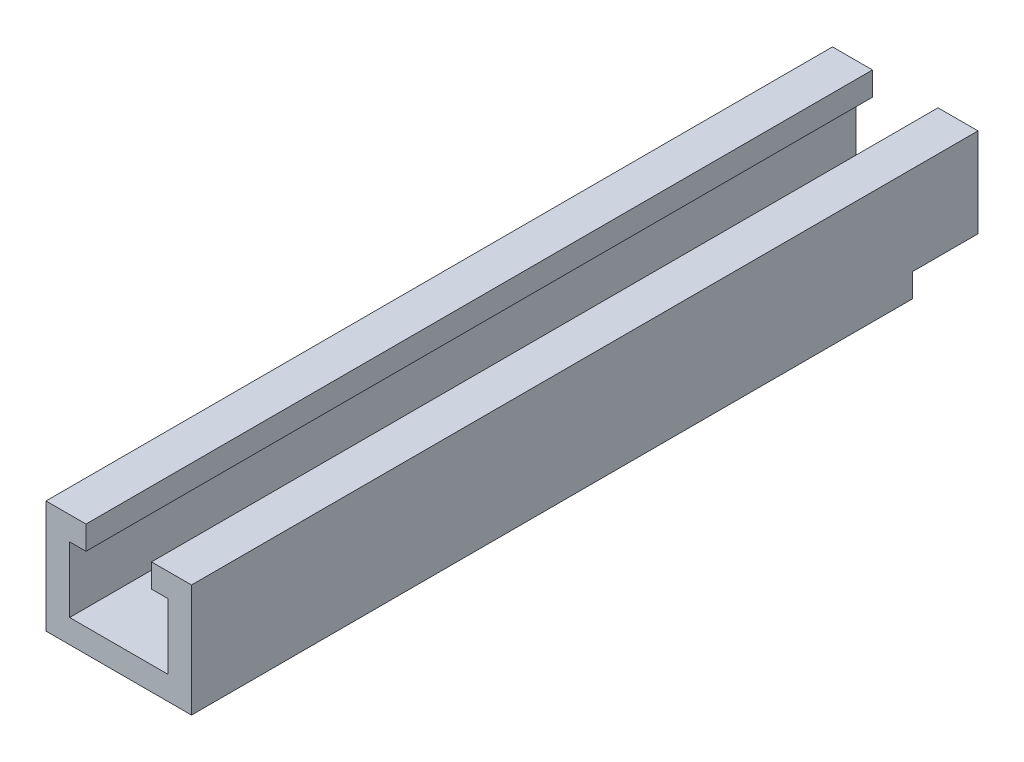
from build123d import *

# Parameters (mm, degrees)
SKETCH1_W                         = 111
SKETCH1_H                         = 18
BASEPLATE_DEPTH                   = 600
SKETCH2_W                         = 18
SKETCH2_H                         = 600
SIDE_RAIL_DEPTH                   = 50
SKETCH3_W                         = 30.5
SKETCH3_H                         = 600
KEEPER_RAIL_DEPTH                 = 18
SKETCH5_W                         = 111
SKETCH5_H                         = 50
LAP_JOINT_CUTOUT_DEPTH            = 18
LAP_JOINT_BOLT_HOLE_PATTERN_D     = 4.2
LAP_JOINT_BOLT_HOLE_PATTERN_DEPTH = 14
LAP_JOINT_BOLT_HOLE_PATTERN_TIP   = 1.2618073
M6_CLEARANCE_HOLE1_D              = 6.6


with BuildPart() as part:
    # Sketch1 → baseplate (new body)
    with BuildSketch(Plane.XY):
        with Locations((55.5, 9)):
            Rectangle(SKETCH1_W, SKETCH1_H)
    extrude(amount=BASEPLATE_DEPTH)

    # Sketch2 → side_rail (add)
    with BuildSketch(Plane(origin=(0, 18, 0), x_dir=(1, 0, 0), z_dir=(0, 1, 0))):
        with Locations((9, -300)):
            Rectangle(SKETCH2_W, SKETCH2_H)
    side_rail = extrude(amount=SIDE_RAIL_DEPTH)

    # Sketch3 → keeper rail (add)
    with BuildSketch(Plane(origin=(0, 68, 0), x_dir=(1, 0, 0), z_dir=(0, 1, 0))):
        with Locations((15.25, -300)):
            Rectangle(SKETCH3_W, SKETCH3_H)
    keeper_rail = extrude(amount=KEEPER_RAIL_DEPTH)

    # mirror rails: side_rail, keeper rail across plane
    add(side_rail.mirror(Plane.ZY.offset(-55.5)))
    add(keeper_rail.mirror(Plane.ZY.offset(-55.5)))

    # Sketch5 → lap joint cutout (cut)
    with BuildSketch(Plane.XZ):
        with Locations((55.5, 25)):
            Rectangle(SKETCH5_W, SKETCH5_H)
    extrude(amount=-LAP_JOINT_CUTOUT_DEPTH, mode=Mode.SUBTRACT)

    # lap joint bolt hole pattern
    with Locations(Plane(origin=(0, 18, 0), x_dir=(-1, 0, 0), z_dir=(0, -1, 0))):
        with Locations((-102, -10), (-9, -40), (-102, -40), (-9, -10)):
            Hole(LAP_JOINT_BOLT_HOLE_PATTERN_D / 2, depth=LAP_JOINT_BOLT_HOLE_PATTERN_DEPTH)
            with Locations((0, 0, -(LAP_JOINT_BOLT_HOLE_PATTERN_DEPTH + LAP_JOINT_BOLT_HOLE_PATTERN_TIP / 2))):  # 118° drill point
                Cone(0, LAP_JOINT_BOLT_HOLE_PATTERN_D / 2, LAP_JOINT_BOLT_HOLE_PATTERN_TIP, mode=Mode.SUBTRACT)

    # M6 Clearance Hole1 (through all)
    with Locations(Plane(origin=(0, 18, 0), x_dir=(1, 0, 0), z_dir=(0, 1, 0))):
        with Locations((37.5, -535), (73.5, -535)):
            Hole(M6_CLEARANCE_HOLE1_D / 2)


solid = part.part
